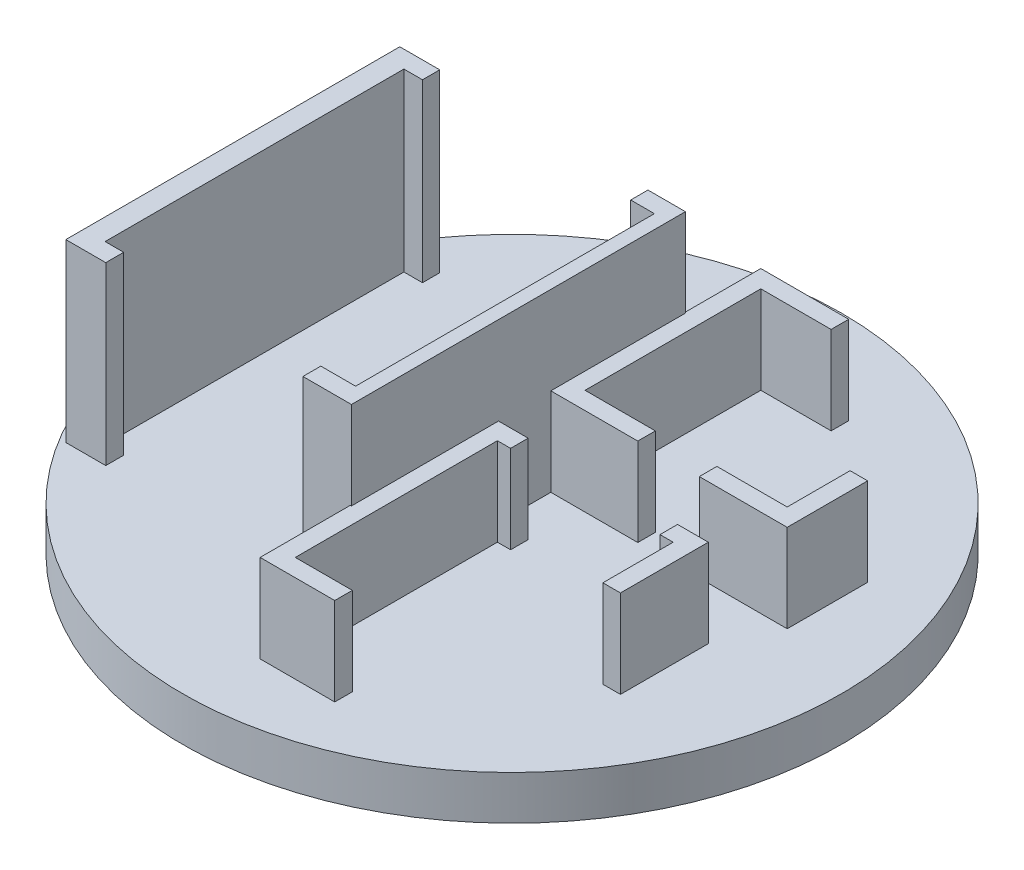
from build123d import *

# Parameters (mm, degrees)
AUFSATZ_LINEAR_AUSTRAGEN1_DEPTH = 5
SKIZZE19_W                      = 32.5
SKIZZE19_H                      = 38
SKIZZE19_W_2                    = 28.5
SKIZZE19_H_2                    = 34
AUFSATZ_LINEAR_AUSTRAGEN2_DEPTH = 20
AUFSATZ_LINEAR_START            = -5
AUFSATZ_LINEAR_AUSTRAGEN3_DEPTH = 5
AUFSATZ_LINEAR_AUSTRAGEN5_DEPTH = 10
SKIZZE22_W                      = 22.434160046
SKIZZE22_H                      = 2.038039055
SKIZZE22_W_2                    = 23.692781995
SKIZZE22_H_2                    = 1.961960945
SCHNITT_LINEAR_AUSTRAGEN1_DEPTH = 20
AUFSATZ_LINEAR_AUSTRAGEN6_DEPTH = 10


with BuildPart() as part:
    # Skizze1 → Aufsatz-Linear austragen1 (new body)
    with BuildSketch(Plane(origin=(0, 0, 0), x_dir=(1, 0, 0), z_dir=(0, 1, 0))):
        with BuildLine():
            Line((0, 0), (0, -75))
            ThreePointArc((0, -75), (-37.5, -37.5), (0, 0))
        make_face()
    extrude(amount=AUFSATZ_LINEAR_AUSTRAGEN1_DEPTH)

    # Skizze19 → Aufsatz-Linear austragen2 (add)
    with BuildSketch(Plane(origin=(0, 5, 0), x_dir=(1, 0, 0), z_dir=(0, 1, 0))):
        with Locations((-15.13754966, -37.887563541)):
            Rectangle(SKIZZE19_W, SKIZZE19_H)
        with Locations((-14.706780052, -37.849524486)):
            Rectangle(SKIZZE19_W_2, SKIZZE19_H_2, mode=Mode.SUBTRACT)
    extrude(amount=AUFSATZ_LINEAR_AUSTRAGEN2_DEPTH)

    # Skizze20 → Aufsatz-Linear austragen3 (add)
    with BuildSketch(Plane(origin=(0, 5, 0), x_dir=(1, 0, 0), z_dir=(0, 1, 0)).offset(AUFSATZ_LINEAR_START)):
        with BuildLine():
            Line((0, -75), (0, 0))
            ThreePointArc((0, 0), (37.5, -37.5), (0, -75))
        make_face()
    extrude(amount=AUFSATZ_LINEAR_AUSTRAGEN3_DEPTH)

    # Skizze15 → Aufsatz-Linear austragen5 (add)
    with BuildSketch(Plane(origin=(0, 5, 0), x_dir=(1, 0, 0), z_dir=(0, 1, 0))):
        Polygon((3.005132857, -32.201126867), (3.005132857, -30.701126867), (3.005132857, -13.701126867), (3.005132857, -12.201126867), (11.005132857, -12.201126867), (11.005132857, -10.201126867), (1.005132857, -10.201126867), (1.005132857, -13.701126867), (1.005132857, -30.701126867), (1.005132857, -34.201126867), (3.005132857, -34.201126867), (11.005132857, -34.201126867), (11.005132857, -32.201126867), align=None)
        Polygon((26.005132857, -32.201126867), (26.005132857, -30.701126867), (26.005132857, -25.042366573), (28.005132857, -25.042366573), (28.005132857, -30.701126867), (28.005132857, -34.201126867), (26.005132857, -34.201126867), (18.005132857, -34.201126867), (18.005132857, -32.201126867), align=None)
    extrude(amount=AUFSATZ_LINEAR_AUSTRAGEN5_DEPTH)

    # Skizze22 → Schnitt-Linear austragen1 (cut)
    with BuildSketch(Plane(origin=(0, 25, 0), x_dir=(1, 0, 0), z_dir=(0, 1, 0))):
        with Locations((-15.626615673, -55.868544013)):
            Rectangle(SKIZZE22_W, SKIZZE22_H)
        with Locations((-14.997304699, -19.868544013)):
            Rectangle(SKIZZE22_W_2, SKIZZE22_H_2)
    extrude(amount=-SCHNITT_LINEAR_AUSTRAGEN1_DEPTH, mode=Mode.SUBTRACT)

    # Skizze25 → Aufsatz-Linear austragen6 (add)
    with BuildSketch(Plane(origin=(0, 5, 0), x_dir=(1, 0, 0), z_dir=(0, 1, 0))):
        Polygon((22.986736962, -42.154729157), (21.486736962, -42.154729157), (21.486736962, -40.154729157), (24.986736962, -40.154729157), (24.986736962, -42.154729157), (24.986736962, -50.154729157), (22.986736962, -50.154729157), align=None)
        Polygon((2.986736962, -65.154729157), (2.986736962, -57.154729157), (2.986736962, -50.154729157), (2.986736962, -42.154729157), (4.486736962, -42.154729157), (4.486736962, -40.154729157), (0.986736962, -40.154729157), (0.986736962, -50.154729157), (0.986736962, -57.154729157), (0.986736962, -67.154729157), (4.486736962, -67.154729157), (9.47801562, -67.154729157), (9.47801562, -65.154729157), (4.486736962, -65.154729157), align=None)
    extrude(amount=AUFSATZ_LINEAR_AUSTRAGEN6_DEPTH)


solid = part.part
